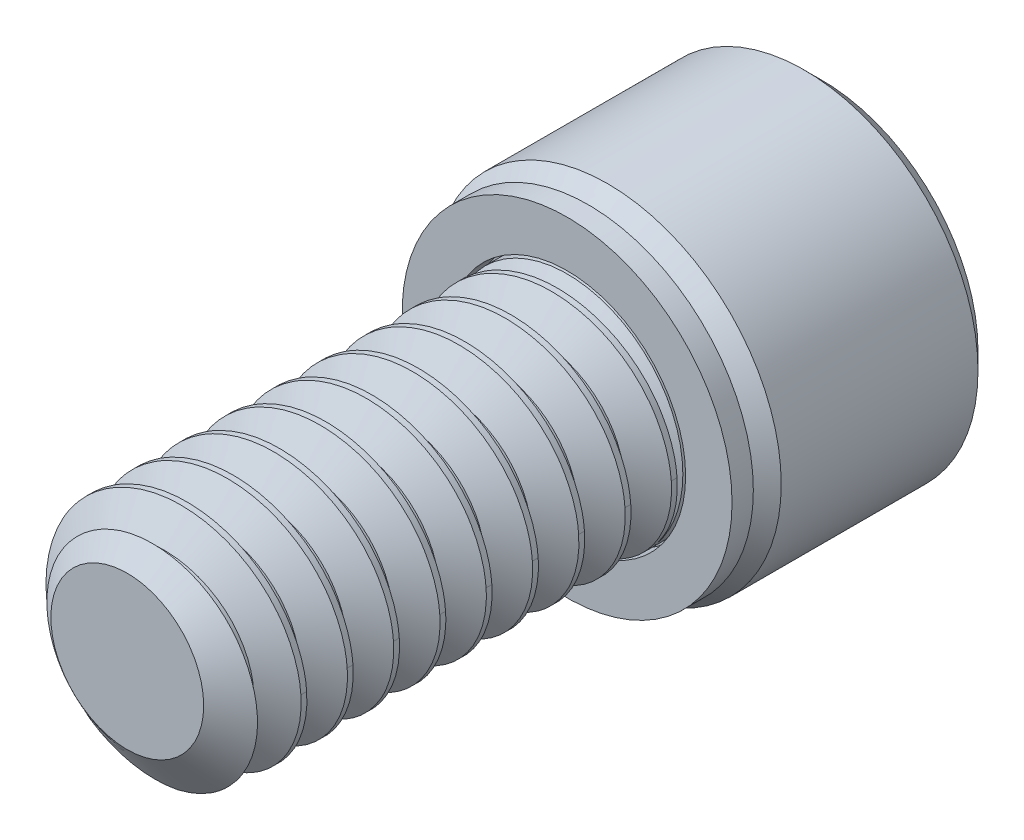
from build123d import *

# Parameters (mm, degrees)
SKETCH1_R           = 3.175
EXTRUDE1_DEPTH      = 12.7
CUT_SWEEP1_PITCH    = 1.27
SKETCH6_R           = 4.7625
EXTRUDE2_DEPTH      = 6.35
CUT_EXTRUDE1_DEPTH  = 3.571875
CHAMFER1_SIZE       = 0.47625
SKETCH11_R          = 3.175
BOSS_EXTRUDE1_DEPTH = 0.635
SKETCH12_R          = 3.175
BOSS_EXTRUDE2_DEPTH = 2.54
BOSS_EXTRUDE2_TAPER = 60
SKETCH14_R          = 4.524375
SKETCH14_R_2        = 3.2512
BOSS_EXTRUDE3_DEPTH = 0.5842


with BuildPart() as part:
    # Sketch1 → Extrude1 (new body)
    with BuildSketch(Plane.XY):
        Circle(SKETCH1_R)
    extrude(amount=-EXTRUDE1_DEPTH)

    # Cut-Sweep1: the profile of Sketch3 profile screwed along a right-hand helix of 11 turns, 6 arcs to a turn; built about Z, then put on its axis
    cut_sweep1_z = Axis((0, 0, 0), (0, 0, 1))
    cut_sweep1_corners = [(3.1753, 0, -1.111423205), (2.350110803, 0, -0.635), (2.350110803, 0, -0.47625), (3.1753, 0, 0.000173205)]
    with BuildLine(mode=Mode.PRIVATE) as cut_sweep1_profile:
        Line(cut_sweep1_corners[0], cut_sweep1_corners[1])
        Line(cut_sweep1_corners[1], cut_sweep1_corners[2])
        Line(cut_sweep1_corners[2], cut_sweep1_corners[3])
        Line(cut_sweep1_corners[3], cut_sweep1_corners[0])
    cut_sweep1_cap = Face(cut_sweep1_profile.wire())
    cut_sweep1_turn_angles = [0, 30, 60, 90, 120, 150, 180, 210, 240, 270, 300, 330, 360]
    cut_sweep1_turn_weights = [1, 0.8660254037844387, 1, 0.8660254037844387, 1, 0.8660254037844387, 1, 0.8660254037844387, 1, 0.8660254037844387, 1, 0.8660254037844387, 1]
    cut_sweep1_turn_rails = [Edge.make_bspline([Vector(p[0], p[1], 0).rotate(cut_sweep1_z, cut_sweep1_turn_angles[k]) / cut_sweep1_turn_weights[k] + Vector(0, 0, p[2] + CUT_SWEEP1_PITCH * cut_sweep1_turn_angles[k] / 360) for k in range(13)], [0, 0, 0, 1, 1, 2, 2, 3, 3, 4, 4, 5, 5, 6, 6, 6], 2, cut_sweep1_turn_weights) for p in cut_sweep1_corners]
    cut_sweep1_turn_sides = [Face.make_surface_from_curves(cut_sweep1_turn_rails[p[0]], cut_sweep1_turn_rails[p[1]]) for p in [(0, 1), (1, 2), (2, 3), (3, 0)]]
    cut_sweep1 = Plane(origin=(0, 0, 0), x_dir=(0, 1, 0), z_dir=(0, 0, -1)) * Solid(Shell([*[p.moved(Location((0, 0, CUT_SWEEP1_PITCH * i))) for i in range(11) for p in cut_sweep1_turn_sides], cut_sweep1_cap, cut_sweep1_cap.rotate(cut_sweep1_z, 3960).moved(Location((0, 0, CUT_SWEEP1_PITCH * 3960 / 360)))]))
    add(cut_sweep1, mode=Mode.SUBTRACT)

    # Sketch4 → Cut-Revolve1 (revolve, cut)
    with BuildSketch(Plane(origin=(0, 0, 0), x_dir=(0, 0, -1), z_dir=(1, 0, 0)), mode=Mode.PRIVATE) as cut_revolve1_sk:
        Polygon((0.755446349, 3.175), (0, 2.096110803), (0, 3.175), align=None)
    revolve(cut_revolve1_sk.sketch.rotate(Axis((0, 0, 0), (0, 0, -1)), 229.892048011), axis=Axis((0, 0, 0), (0, 0, -1)), mode=Mode.SUBTRACT)

    # Sketch6 → Extrude2 (add)
    with BuildSketch(Plane(origin=(0, 0, -12.7), x_dir=(-1, 0, 0), z_dir=(0, 0, -1))):
        Circle(SKETCH6_R)
    extrude(amount=EXTRUDE2_DEPTH)

    # Sketch7 → Cut-Extrude1 (cut)
    with BuildSketch(Plane(origin=(0, 0, -19.05), x_dir=(-1, 0, 0), z_dir=(0, 0, -1))):
        Polygon((0, 2.749630657), (-2.38125, 1.374815329), (-2.38125, -1.374815329), (0, -2.749630657), (2.38125, -1.374815329), (2.38125, 1.374815329), align=None)
    extrude(amount=-CUT_EXTRUDE1_DEPTH, mode=Mode.SUBTRACT)

    # Cut-Extrude2 cone 1 section (through the dimple's axis) → Cut-Extrude2 (revolve, cut)
    with BuildSketch(Plane(origin=(0, 0, -19.05), x_dir=(0, 1, 0), z_dir=(1, 0, 0))):
        Polygon((0, 0), (2.749630657, 0), (0, 2.749630657), align=None)
    revolve(axis=Axis((0, 0, -19.05), (0, 0, 1)), mode=Mode.SUBTRACT)

    # Chamfer1
    chamfer1_edges = [part.edges().sort_by_distance(p)[0] for p in [
        (4.7625, 0, -12.7),
        (4.7625, 0, -19.05),
    ]]
    chamfer(chamfer1_edges, length=CHAMFER1_SIZE)



with BuildPart() as body_2:
    # Sketch11 → Boss-Extrude1 (new body)
    with BuildSketch(Plane.XY.offset(-12.7)):
        Circle(SKETCH11_R)
    extrude(amount=BOSS_EXTRUDE1_DEPTH)


with BuildPart() as part_1:
    add(part.part)

    add(body_2.part)  # Boss-Extrude2 merges body 2
    # Sketch12 → Boss-Extrude2 (add)
    with BuildSketch(Plane.XY.offset(-12.065)):
        Circle(SKETCH12_R)
    extrude(amount=BOSS_EXTRUDE2_DEPTH, taper=BOSS_EXTRUDE2_TAPER)


with BuildPart() as body_2_2:
    # Sketch14 → Boss-Extrude3 (new body)
    with BuildSketch(Plane.XY.offset(-12.6492)):
        Circle(SKETCH14_R)
        Circle(SKETCH14_R_2, mode=Mode.SUBTRACT)
    extrude(amount=BOSS_EXTRUDE3_DEPTH)


solid = Compound([part_1.part, body_2_2.part])
